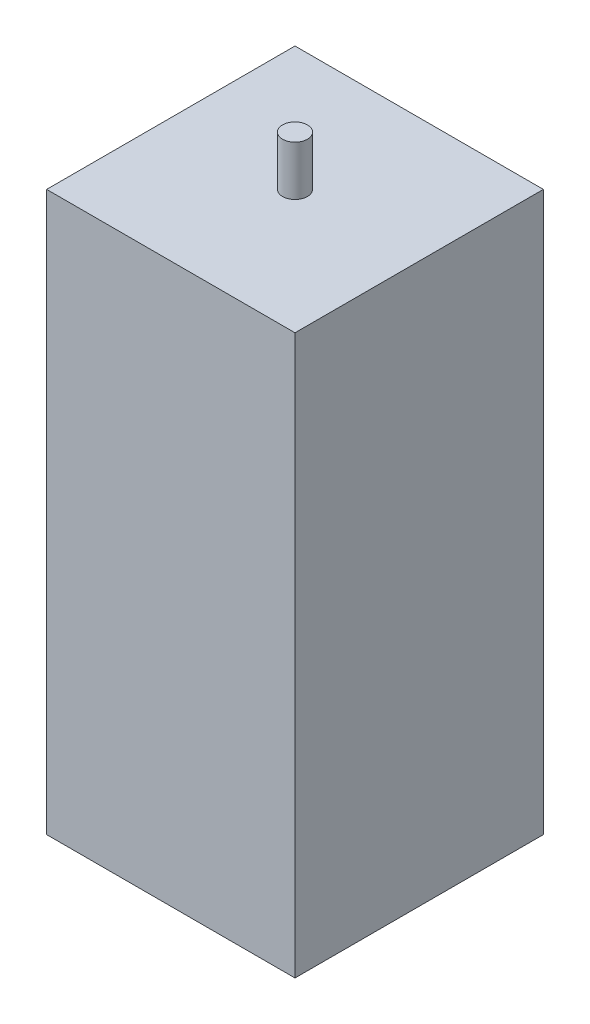
from build123d import *

# Parameters (mm, degrees)
SKETCH_1_W           = 10
SKETCH_1_H           = 22.5
EXTRUDE_1_DEPTH      = 10
EXTRUDE_2_DEPTH      = 2
EXTRUDE_2_DEPTH_BACK = 24.5
SKETCH_2_R           = 0.5


with BuildPart() as part:
    # 草图1 → 凸台-拉伸1 (new body)
    with BuildSketch(Plane.XY):
        Rectangle(SKETCH_1_W, SKETCH_1_H)
    extrude(amount=EXTRUDE_1_DEPTH)

    # 草图2 → 凸台-拉伸2 (add, two sides: drawn at the far end of the back side and taken through both)
    with BuildSketch(Plane(origin=(0, 11.25, 0), x_dir=(1, 0, 0), z_dir=(0, 1, 0)).offset(-EXTRUDE_2_DEPTH_BACK)):
        with Locations((0, -5)):
            Circle(SKETCH_2_R)
    extrude(amount=EXTRUDE_2_DEPTH + EXTRUDE_2_DEPTH_BACK)


solid = part.part
